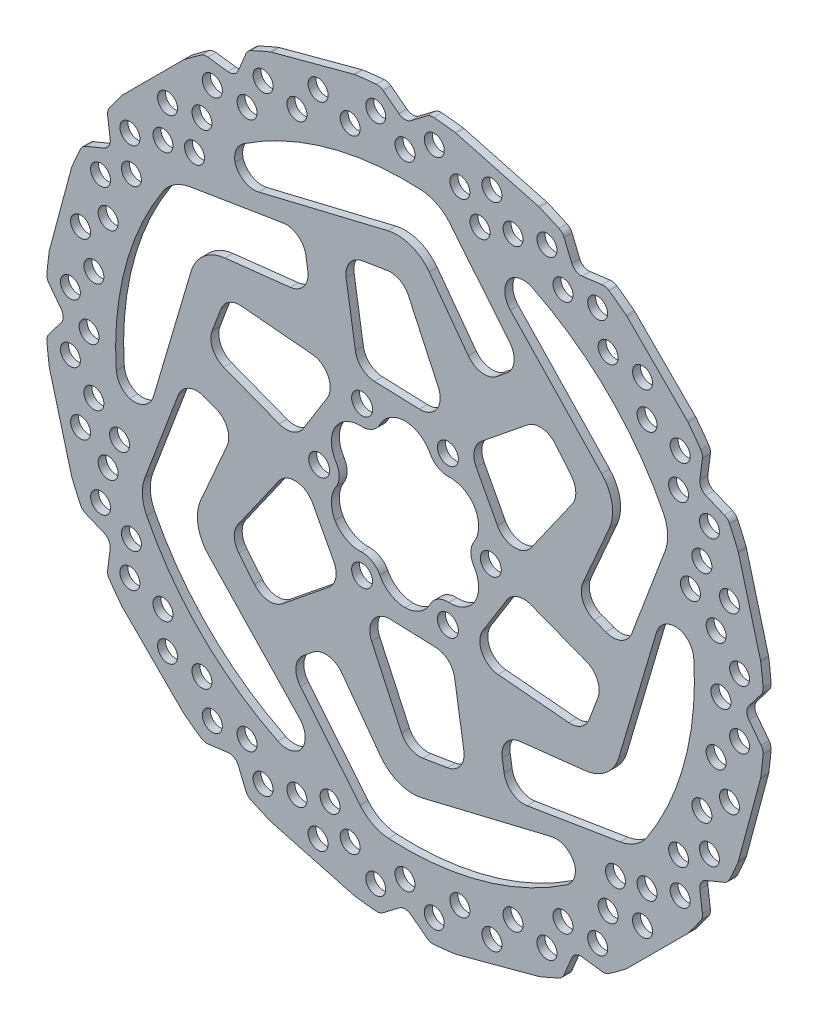
from build123d import *

# Parameters (mm, degrees)
BOSS_EXTRUDE1_DEPTH      = 1
BOSS_EXTRUDE1_DEPTH_BACK = 1
SKETCH3_R                = 90
CUT_EXTRUDE1_DEPTH       = 128.283148924
CUT_EXTRUDE1_DEPTH_BACK  = 128.283148924
SKETCH4_R                = 2.625
FILLET1_R                = 7.25
CUT_EXTRUDE2_DEPTH       = 128.283148924
FILLET2_R                = 5
FILLET3_R                = 10
CIRPATTERN1_COUNT        = 6
FILLET2_OF_CIRPATTERN1_R = 5
FILLET3_OF_CIRPATTERN1_R = 10
CUT_EXTRUDE3_DEPTH       = 128.283148924
CUT_EXTRUDE3_DEPTH_BACK  = 128.283148924
CUT_EXTRUDE4_DEPTH       = 128.283148924
CUT_EXTRUDE4_DEPTH_BACK  = 128.283148924
FILLET4_R                = 2.5
SKETCH8_R                = 2.5
CUT_EXTRUDE5_DEPTH       = 127.885081237
CIRPATTERN2_COUNT        = 6


with BuildPart() as part:
    # Sketch3 → Boss-Extrude1 (new, two sides: drawn at the far end of the back side and taken through both)
    with BuildSketch(Plane.XY.offset(-BOSS_EXTRUDE1_DEPTH_BACK)):
        Circle(SKETCH3_R)
    extrude(amount=BOSS_EXTRUDE1_DEPTH + BOSS_EXTRUDE1_DEPTH_BACK)

    # Sketch4 → Cut-Extrude1 (cut, two sides: drawn at the far end of the back side and taken through both)
    with BuildSketch(Plane.XY.offset(-CUT_EXTRUDE1_DEPTH_BACK)):
        with BuildLine():
            ThreePointArc((19.70494186, -4.666665434), (17.378392868, -2.830610297), (16.5, 0))
            ThreePointArc((16.5, 0), (17.378392868, 2.830610297), (19.70494186, 4.666665434))
            ThreePointArc((19.70494186, 4.666665434), (17.537014427, 10.125), (13.893921747, 14.731647514))
            ThreePointArc((13.893921747, 14.731647514), (8.25, 14.289419162), (5.811020113, 19.398312948))
            ThreePointArc((5.811020113, 19.398312948), (0, 20.25), (-5.811020113, 19.398312948))
            ThreePointArc((-5.811020113, 19.398312948), (-8.25, 14.289419162), (-13.893921747, 14.731647514))
            ThreePointArc((-13.893921747, 14.731647514), (-17.537014427, 10.125), (-19.70494186, 4.666665434))
            ThreePointArc((-19.70494186, 4.666665434), (-16.5, 0), (-19.70494186, -4.666665434))
            ThreePointArc((-19.70494186, -4.666665434), (-17.537014427, -10.125), (-13.893921747, -14.731647514))
            ThreePointArc((-13.893921747, -14.731647514), (-8.25, -14.289419162), (-5.811020113, -19.398312948))
            ThreePointArc((-5.811020113, -19.398312948), (0, -20.25), (5.811020113, -19.398312948))
            ThreePointArc((5.811020113, -19.398312948), (8.25, -14.289419162), (13.893921747, -14.731647514))
            ThreePointArc((13.893921747, -14.731647514), (17.537014427, -10.125), (19.70494186, -4.666665434))
        make_face()
        with Locations((21.5, 0)):
            Circle(SKETCH4_R)
        with Locations((10.75, 18.619546181)):
            Circle(SKETCH4_R)
        with Locations((10.75, -18.619546181)):
            Circle(SKETCH4_R)
        with Locations((-10.75, 18.619546181)):
            Circle(SKETCH4_R)
        with Locations((-10.75, -18.619546181)):
            Circle(SKETCH4_R)
        with Locations((-21.5, 0)):
            Circle(SKETCH4_R)
    extrude(amount=CUT_EXTRUDE1_DEPTH + CUT_EXTRUDE1_DEPTH_BACK, mode=Mode.SUBTRACT)

    # Fillet1
    # the kernel refuses this fillet: 7.25 mm, written as the material it adds along each edge
    with BuildSketch(Plane(origin=(19.70494186, 4.666665434, -1), x_dir=(-0.7752261871537995, -0.6316837490002274, 0), z_dir=(0, 0, 1)), Plane(origin=(19.70494186, -4.666665434, 1), x_dir=(-0.7752261871537981, 0.6316837490002291, 0), z_dir=(0, 0, -1)), Plane(origin=(-5.811020113, -19.398312948, -1), x_dir=(-0.15944108021504277, 0.9872074462542613, 0), z_dir=(0, 0, 1)), Plane(origin=(-19.70494186, -4.666665434, -1), x_dir=(0.775226187153803, 0.631683749000223, 0), z_dir=(0, 0, 1)), Plane(origin=(-13.893921747, 14.731647514, -1), x_dir=(0.934667267368866, -0.3555236972540884, 0), z_dir=(0, 0, 1)), Plane(origin=(5.811020113, 19.398312948, -1), x_dir=(0.1594410802150379, -0.9872074462542622, 0), z_dir=(0, 0, 1))) as fillet1_piece_1:
        with BuildLine():
            CenterArc((5.369168207, -6.889863945), FILLET1_R, 108.134946901, 63.284010814)
            ThreePointArc((-1.799673875, -5.808104633), (-1.119081846, -2.836118049), (0, 0))
            ThreePointArc((0, 0), (1.55628064, -0.248369693), (3.112561279, 0))
        make_face()
    extrude(amount=2)
    with BuildSketch(Plane(origin=(13.893921747, -14.731647514, 1), x_dir=(-0.934667267368868, 0.3555236972540833, 0), z_dir=(0, 0, -1))) as fillet1_piece_2:
        with BuildLine():
            CenterArc((5.369168207, 6.889863945), FILLET1_R, 188.581042285, 63.284010814)
            ThreePointArc((-1.799673875, 5.808104633), (-1.119081846, 2.836118049), (0, 0))
            ThreePointArc((0, 0), (1.55628064, 0.248369693), (3.112561279, 0))
        make_face()
    extrude(amount=2)
    with BuildSketch(Plane(origin=(5.811020113, -19.398312948, 1), x_dir=(-0.9901671681393868, -0.13988916733910237, 0), z_dir=(0, 0, -1))) as fillet1_piece_3:
        with BuildLine():
            CenterArc((4.992044139, 7.167823081), FILLET1_R, 215.35083581, 63.284010814)
            ThreePointArc((-0.921233946, 2.973107084), (-0.223375155, 1.560064253), (0, 0))
            ThreePointArc((0, 0), (3.040267483, -0.229528636), (6.080534967, 0))
        make_face()
    extrude(amount=2)
    with BuildSketch(Plane(origin=(-13.893921747, -14.731647514, -1), x_dir=(-0.6162311566996095, 0.7875653379324546, 0), z_dir=(0, 0, 1)), Plane(origin=(-19.70494186, 4.666665434, -1), x_dir=(0.37393601143979244, 0.927454505271552, 0), z_dir=(0, 0, 1)), Plane(origin=(-5.811020113, 19.398312948, -1), x_dir=(0.9901671681393878, 0.1398891673390949, 0), z_dir=(0, 0, 1)), Plane(origin=(13.893921747, 14.731647514, -1), x_dir=(0.6162311566996038, -0.787565337932459, 0), z_dir=(0, 0, 1))) as fillet1_piece_4:
        with BuildLine():
            CenterArc((4.992044139, -7.167823081), FILLET1_R, 81.365153376, 63.284010814)
            ThreePointArc((-0.921233946, -2.973107084), (-0.223375155, -1.560064253), (0, 0))
            ThreePointArc((0, 0), (3.040267483, 0.229528636), (6.080534967, 0))
        make_face()
    extrude(amount=2)

    # Sketch5 → Cut-Extrude2 (cut, symmetric)
    with BuildSketch(Plane.XY):
        Polygon((11.782448297, 24.332502266), (-0.719059801, 51.289888884), (-15.522638582, 48.870373376), (-11.782448297, 25.163602684), align=None)
        Polygon((-25.625607459, 48.739034198), (-53.640000232, 44.160326661), (-51.704387826, 32.317463636), (-23.530364561, 35.458575412), align=None)
        with BuildLine():
            Line((-53.640000232, 44.160326661), (-58.044631032, 43.440428271))
            ThreePointArc((-58.044631032, 43.440428271), (-70.012394298, 18.828559284), (-72.003979745, -8.46622117))
            Line((-72.003979745, -8.46622117), (-64.419336412, -10.707663695))
            Line((-64.419336412, -10.707663695), (-51.704387826, 32.317463636))
            Line((-51.704387826, 32.317463636), (-53.640000232, 44.160326661))
        make_face()
    cut_extrude2 = extrude(amount=CUT_EXTRUDE2_DEPTH, both=True, mode=Mode.SUBTRACT)

    # Fillet2
    # the kernel refuses this fillet: 5 mm, written as the material it adds along each edge
    with BuildSketch(Plane(origin=(-11.782448297, 25.163602684, 1), x_dir=(0.9993786432729305, -0.035246664664287344, 0), z_dir=(0, 0, -1))) as fillet2_piece_1:
        with BuildLine():
            CenterArc((FILLET2_R * 0.824549025934, -FILLET2_R), FILLET2_R, 90, 79.014506566)
            Line((-FILLET2_R * 0.157126436471, -FILLET2_R * 0.80943954631), (0, 0))
            Line((0, 0), (FILLET2_R * 0.824549025934, 0))
        make_face()
    extrude(amount=2)
    with BuildSketch(Plane(origin=(-0.719059801, 51.289888884, -1), x_dir=(0.4207120080891837, -0.9071942494579465, 0), z_dir=(0, 0, 1))) as fillet2_piece_2:
        with BuildLine():
            CenterArc((FILLET2_R * 0.759080833658, -FILLET2_R), FILLET2_R, 90, 74.402873242)
            Line((-FILLET2_R * 0.204095217592, -FILLET2_R * 0.731128479943), (0, 0))
            Line((0, 0), (FILLET2_R * 0.759080833658, 0))
        make_face()
    extrude(amount=2)
    with BuildSketch(Plane(origin=(11.782448297, 24.332502266, 1), x_dir=(-0.42071200808918324, 0.9071942494579465, 0), z_dir=(0, 0, -1))) as fillet2_piece_3:
        with BuildLine():
            CenterArc((FILLET2_R * 1.62864222131, -FILLET2_R), FILLET2_R, 90, 116.899451201)
            Line((FILLET2_R * 0.736840358169, -FILLET2_R * 1.45242616735), (0, 0))
            Line((0, 0), (FILLET2_R * 1.62864222131, 0))
        make_face()
    extrude(amount=2)
    with BuildSketch(Plane(origin=(-15.522638582, 48.870373376, -1), x_dir=(0.15584126183718117, -0.9877821121628976, 0), z_dir=(0, 0, 1))) as fillet2_piece_4:
        with BuildLine():
            CenterArc((FILLET2_R * 0.994485488589, FILLET2_R), FILLET2_R, 180.316831009, 89.683168991)
            Line((-FILLET2_R * 0.005499222414, FILLET2_R * 0.994470283903), (0, 0))
            Line((0, 0), (FILLET2_R * 0.994485488589, 0))
        make_face()
    extrude(amount=2)
    with BuildSketch(Plane(origin=(-64.419336412, -10.707663695, 1), x_dir=(0.28340721234532945, 0.9589996621431363, 0), z_dir=(0, 0, -1))) as fillet2_piece_5:
        with BuildLine():
            CenterArc((FILLET2_R, -FILLET2_R), FILLET2_R, 90, 90)
            Line((0, -FILLET2_R), (0, 0))
            Line((0, 0), (FILLET2_R, 0))
        make_face()
    extrude(amount=2)
    with BuildSketch(Plane(origin=(-72.003979745, -8.46622117, -1), x_dir=(0.9589996621431376, -0.2834072123453247, 0), z_dir=(0, 0, 1))) as fillet2_piece_6:
        with BuildLine():
            CenterArc((3.384730865, 5), FILLET2_R, 200.397226298, 69.602773702)
            ThreePointArc((-1.301763449, 3.257366636), (-0.670585229, 1.620809073), (0, 0))
            Line((0, 0), (3.384730865, 0))
        make_face()
    extrude(amount=2)
    with BuildSketch(Plane(origin=(-23.530364561, 35.458575412, 1), x_dir=(-0.1558412618371813, 0.9877821121628976, 0), z_dir=(0, 0, -1))) as fillet2_piece_7:
        with BuildLine():
            CenterArc((FILLET2_R * 1.04651290744, -FILLET2_R), FILLET2_R, 90, 92.603975326)
            Line((FILLET2_R * 0.0475454874519, -FILLET2_R * 1.04543229913), (0, 0))
            Line((0, 0), (FILLET2_R * 1.04651290744, 0))
        make_face()
    extrude(amount=2)
    with BuildSketch(Plane(origin=(-25.625607459, 48.739034198, -1), x_dir=(0.15584126183718192, -0.9877821121628975, 0), z_dir=(0, 0, 1))) as fillet2_piece_8:
        with BuildLine():
            CenterArc((FILLET2_R * 1.00554508987, -FILLET2_R), FILLET2_R, 90, 90.316831009)
            Line((FILLET2_R * 0.00556037886924, -FILLET2_R * 1.0055297161), (0, 0))
            Line((0, 0), (FILLET2_R * 1.00554508987, 0))
        make_face()
    extrude(amount=2)

    # Fillet3
    fillet3_edges = [part.edges().sort_by_distance(p)[0] for p in [
        (-58.044631032, 43.440428271, 0),
        (-51.704387826, 32.317463636, 0),
    ]]
    fillet(fillet3_edges, radius=FILLET3_R)

    # CirPattern1: Cut-Extrude2 ×6 about axis
    cirpattern1_axis = Axis((0, 0, 0), (0, 0, 1))
    for i in range(1, CIRPATTERN1_COUNT):
        add(cut_extrude2.rotate(cirpattern1_axis, i * 360 / CIRPATTERN1_COUNT), mode=Mode.SUBTRACT)

    # Fillet2 of CirPattern1
    # the kernel refuses this fillet: 5 mm, written as the material it adds along each edge
    with BuildSketch(Plane(origin=(-27.683543324, 2.377901798, 1), x_dir=(0.5302138286344097, 0.8478639607418403, 0), z_dir=(0, 0, -1)), Plane(origin=(-15.901095027, -22.785700887, 1), x_dir=(-0.46916481463852117, 0.8831106254061278, 0), z_dir=(0, 0, -1)), Plane(origin=(11.782448297, -25.163602684, 1), x_dir=(-0.9993786432729305, 0.03524666466428733, 0), z_dir=(0, 0, -1)), Plane(origin=(27.683543324, -2.377901798, 1), x_dir=(-0.5302138286344099, -0.84786396074184, 0), z_dir=(0, 0, -1)), Plane(origin=(15.901095027, 22.785700887, 1), x_dir=(0.4691648146385218, -0.8831106254061274, 0), z_dir=(0, 0, -1))) as fillet2_of_cirpattern1_piece_1:
        with BuildLine():
            CenterArc((FILLET2_OF_CIRPATTERN1_R * 0.824549025934, -FILLET2_OF_CIRPATTERN1_R), FILLET2_OF_CIRPATTERN1_R, 90, 79.014506566)
            Line((-FILLET2_OF_CIRPATTERN1_R * 0.157126436471, -FILLET2_OF_CIRPATTERN1_R * 0.80943954631), (0, 0))
            Line((0, 0), (FILLET2_OF_CIRPATTERN1_R * 0.824549025934, 0))
        make_face()
    extrude(amount=2)
    with BuildSketch(Plane(origin=(-44.777876631, 25.022220387, -1), x_dir=(0.9960092702423304, -0.0892498380465772, 0), z_dir=(0, 0, 1)), Plane(origin=(-44.05881683, -26.267668496, -1), x_dir=(0.5752972621531476, 0.81794441141137, 0), z_dir=(0, 0, 1)), Plane(origin=(0.719059801, -51.289888884, -1), x_dir=(-0.420712008089183, 0.9071942494579467, 0), z_dir=(0, 0, 1)), Plane(origin=(44.777876631, -25.022220387, -1), x_dir=(-0.9960092702423304, 0.08924983804657703, 0), z_dir=(0, 0, 1)), Plane(origin=(44.05881683, 26.267668496, -1), x_dir=(-0.5752972621531467, -0.8179444114113706, 0), z_dir=(0, 0, 1))) as fillet2_of_cirpattern1_piece_2:
        with BuildLine():
            CenterArc((FILLET2_OF_CIRPATTERN1_R * 0.759080833658, -FILLET2_OF_CIRPATTERN1_R), FILLET2_OF_CIRPATTERN1_R, 90, 74.402873242)
            Line((-FILLET2_OF_CIRPATTERN1_R * 0.204095217592, -FILLET2_OF_CIRPATTERN1_R * 0.731128479943), (0, 0))
            Line((0, 0), (FILLET2_OF_CIRPATTERN1_R * 0.759080833658, 0))
        make_face()
    extrude(amount=2)
    with BuildSketch(Plane(origin=(-15.181340952, 22.370150678, 1), x_dir=(-0.9960092702423307, 0.0892498380465763, 0), z_dir=(0, 0, -1)), Plane(origin=(-26.963789249, -1.962351589, 1), x_dir=(-0.5752972621531475, -0.8179444114113701, 0), z_dir=(0, 0, -1)), Plane(origin=(-11.782448297, -24.332502266, 1), x_dir=(0.4207120080891829, -0.9071942494579467, 0), z_dir=(0, 0, -1)), Plane(origin=(15.181340952, -22.370150678, 1), x_dir=(0.9960092702423304, -0.08924983804657716, 0), z_dir=(0, 0, -1)), Plane(origin=(26.963789249, 1.962351589, 1), x_dir=(0.5752972621531471, 0.8179444114113702, 0), z_dir=(0, 0, -1))) as fillet2_of_cirpattern1_piece_3:
        with BuildLine():
            CenterArc((FILLET2_OF_CIRPATTERN1_R * 1.62864222131, -FILLET2_OF_CIRPATTERN1_R), FILLET2_OF_CIRPATTERN1_R, 90, 116.899451201)
            Line((FILLET2_OF_CIRPATTERN1_R * 0.736840358169, -FILLET2_OF_CIRPATTERN1_R * 1.45242616735), (0, 0))
            Line((0, 0), (FILLET2_OF_CIRPATTERN1_R * 1.62864222131, 0))
        make_face()
    extrude(amount=2)
    with BuildSketch(Plane(origin=(-50.084304127, 10.992187343, -1), x_dir=(0.3537618330654844, 0.9353355363002885, 0), z_dir=(0, 0, 1)), Plane(origin=(-34.561665545, -37.878186033, -1), x_dir=(-0.6331434189656489, 0.7740345024742044, 0), z_dir=(0, 0, 1)), Plane(origin=(15.522638582, -48.870373376, -1), x_dir=(-0.9869052520311341, -0.1613010338260852, 0), z_dir=(0, 0, 1)), Plane(origin=(50.084304127, -10.992187343, -1), x_dir=(-0.35376183306548464, -0.9353355363002885, 0), z_dir=(0, 0, 1))) as fillet2_of_cirpattern1_piece_4:
        with BuildLine():
            CenterArc((FILLET2_OF_CIRPATTERN1_R * 0.994485488589, -FILLET2_OF_CIRPATTERN1_R), FILLET2_OF_CIRPATTERN1_R, 90, 89.683168991)
            Line((-FILLET2_OF_CIRPATTERN1_R * 0.005499222414, -FILLET2_OF_CIRPATTERN1_R * 0.994470283903), (0, 0))
            Line((0, 0), (FILLET2_OF_CIRPATTERN1_R * 0.994485488589, 0))
        make_face()
    extrude(amount=2)
    with BuildSketch(Plane(origin=(-22.936559431, -61.142613675, 1), x_dir=(-0.6888144634639863, 0.7249376765783528, 0), z_dir=(0, 0, -1)), Plane(origin=(41.482776981, -50.43494998, 1), x_dir=(-0.9722216758093141, -0.23406198556478378, 0), z_dir=(0, 0, -1)), Plane(origin=(64.419336412, 10.707663695, 1), x_dir=(-0.2834072123453266, -0.958999662143137, 0), z_dir=(0, 0, -1)), Plane(origin=(22.936559431, 61.142613675, 1), x_dir=(0.6888144634639857, -0.7249376765783536, 0), z_dir=(0, 0, -1)), Plane(origin=(-41.482776981, 50.43494998, 1), x_dir=(0.9722216758093141, 0.23406198556478378, 0), z_dir=(0, 0, -1))) as fillet2_of_cirpattern1_piece_5:
        with BuildLine():
            CenterArc((FILLET2_OF_CIRPATTERN1_R, -FILLET2_OF_CIRPATTERN1_R), FILLET2_OF_CIRPATTERN1_R, 90, 90)
            Line((0, -FILLET2_OF_CIRPATTERN1_R), (0, 0))
            Line((0, 0), (FILLET2_OF_CIRPATTERN1_R, 0))
        make_face()
    extrude(amount=2)
    with BuildSketch(Plane(origin=(-28.670027265, -66.590386218, -1), x_dir=(-0.9086525442541338, 0.4175530550965821, 0), z_dir=(0, 0, 1)), Plane(origin=(43.33395248, -58.124165047, -1), x_dir=(-0.8159378252685093, -0.5781396589891541, 0), z_dir=(0, 0, 1)), Plane(origin=(72.003979745, 8.46622117, -1), x_dir=(0.09271471898562496, -0.9956927140857348, 0), z_dir=(0, 0, 1)), Plane(origin=(28.670027265, 66.590386218, -1), x_dir=(0.9086525442541363, -0.41755305509657686, 0), z_dir=(0, 0, 1))) as fillet2_of_cirpattern1_piece_6:
        with BuildLine():
            CenterArc((3.386891562, -4.998536644), FILLET2_OF_CIRPATTERN1_R, 88.61376053, 69.602773702)
            Line((-1.25607322, -3.143037241), (0, 0))
            ThreePointArc((0, 0), (1.753925987, 0.021218666), (3.507851975, 0))
        make_face()
    extrude(amount=2)
    with BuildSketch(Plane(origin=(-42.473209369, -2.648605764, 1), x_dir=(-0.9333650334555095, 0.358928564372628, 0), z_dir=(0, 0, -1)), Plane(origin=(-18.942844808, -38.107181176, 1), x_dir=(-0.7775237716183285, -0.6288535477902699, 0), z_dir=(0, 0, -1)), Plane(origin=(23.530364561, -35.458575412, 1), x_dir=(0.15584126183718108, -0.9877821121628976, 0), z_dir=(0, 0, -1)), Plane(origin=(42.473209369, 2.648605764, 1), x_dir=(0.9333650334555095, -0.3589285643726278, 0), z_dir=(0, 0, -1)), Plane(origin=(18.942844808, 38.107181176, 1), x_dir=(0.7775237716183285, 0.6288535477902699, 0), z_dir=(0, 0, -1))) as fillet2_of_cirpattern1_piece_7:
        with BuildLine():
            CenterArc((FILLET2_OF_CIRPATTERN1_R * 1.04651290744, -FILLET2_OF_CIRPATTERN1_R), FILLET2_OF_CIRPATTERN1_R, 90, 92.603975326)
            Line((FILLET2_OF_CIRPATTERN1_R * 0.0475454874519, -FILLET2_OF_CIRPATTERN1_R * 1.04543229913), (0, 0))
            Line((0, 0), (FILLET2_OF_CIRPATTERN1_R * 1.04651290744, 0))
        make_face()
    extrude(amount=2)
    with BuildSketch(Plane(origin=(-55.022045501, 2.177090052, -1), x_dir=(0.9333650334555099, -0.3589285643726268, 0), z_dir=(0, 0, 1)), Plane(origin=(-29.396438042, -46.561944146, -1), x_dir=(0.7775237716183281, 0.6288535477902705, 0), z_dir=(0, 0, 1)), Plane(origin=(25.625607459, -48.739034198, -1), x_dir=(-0.15584126183718125, 0.9877821121628976, 0), z_dir=(0, 0, 1)), Plane(origin=(55.022045501, -2.177090052, -1), x_dir=(-0.9333650334555096, 0.3589285643726276, 0), z_dir=(0, 0, 1)), Plane(origin=(29.396438042, 46.561944146, -1), x_dir=(-0.7775237716183279, -0.6288535477902709, 0), z_dir=(0, 0, 1))) as fillet2_of_cirpattern1_piece_8:
        with BuildLine():
            CenterArc((FILLET2_OF_CIRPATTERN1_R * 1.00554508987, -FILLET2_OF_CIRPATTERN1_R), FILLET2_OF_CIRPATTERN1_R, 90, 90.316831009)
            Line((FILLET2_OF_CIRPATTERN1_R * 0.00556037886924, -FILLET2_OF_CIRPATTERN1_R * 1.0055297161), (0, 0))
            Line((0, 0), (FILLET2_OF_CIRPATTERN1_R * 1.00554508987, 0))
        make_face()
    extrude(amount=2)
    with BuildSketch(Plane(origin=(34.561665545, 37.878186033, -1), x_dir=(-0.7775237716183283, -0.6288535477902701, 0), z_dir=(0, 0, 1))) as fillet2_of_cirpattern1_piece_9:
        with BuildLine():
            CenterArc((FILLET2_OF_CIRPATTERN1_R * 0.994485488589, FILLET2_OF_CIRPATTERN1_R), FILLET2_OF_CIRPATTERN1_R, 180.316831009, 89.683168991)
            Line((-FILLET2_OF_CIRPATTERN1_R * 0.005499222414, FILLET2_OF_CIRPATTERN1_R * 0.994470283903), (0, 0))
            Line((0, 0), (FILLET2_OF_CIRPATTERN1_R * 0.994485488589, 0))
        make_face()
    extrude(amount=2)
    with BuildSketch(Plane(origin=(-43.33395248, 58.124165047, -1), x_dir=(0.2340619855647869, -0.9722216758093133, 0), z_dir=(0, 0, 1))) as fillet2_of_cirpattern1_piece_10:
        with BuildLine():
            CenterArc((3.384730865, 5), FILLET2_OF_CIRPATTERN1_R, 200.397226298, 69.602773702)
            ThreePointArc((-1.301763449, 3.257366636), (-0.670585229, 1.620809073), (0, 0))
            Line((0, 0), (3.384730865, 0))
        make_face()
    extrude(amount=2)

    # Fillet3 of CirPattern1
    fillet3_of_cirpattern1_edges = [part.edges().sort_by_distance(p)[0] for p in [
        (-66.64282995, -28.547910892, 0),
        (-53.839938408, -28.618581527, 0),
        (-8.598198918, -71.988339162, 0),
        (-2.135550582, -60.936045163, 0),
        (58.044631032, -43.440428271, 0),
        (51.704387826, -32.317463636, 0),
        (66.64282995, 28.547910892, 0),
        (53.839938408, 28.618581527, 0),
        (8.598198918, 71.988339162, 0),
        (2.135550582, 60.936045163, 0),
    ]]
    fillet(fillet3_of_cirpattern1_edges, radius=FILLET3_OF_CIRPATTERN1_R)

    # Sketch6 → Cut-Extrude3 (cut, two sides: drawn at the far end of the back side and taken through both)
    with BuildSketch(Plane.XY.offset(-CUT_EXTRUDE3_DEPTH_BACK)):
        with BuildLine():
            ThreePointArc((89.102154811, 12.680930881), (86.933324366, 23.293714059), (83.505195039, 33.569069119))
            Line((83.505195039, 33.569069119), (89.102154811, 12.680930881))
        make_face()
        with BuildLine():
            ThreePointArc((83.505195039, -33.569069119), (86.933324366, -23.293714059), (89.102154811, -12.680930881))
            Line((89.102154811, -12.680930881), (83.505195039, -33.569069119))
        make_face()
        with BuildLine():
            ThreePointArc((55.533085692, -70.824264158), (63.639610307, -63.639610307), (70.824264158, -55.533085692))
            Line((70.824264158, -55.533085692), (55.533085692, -70.824264158))
        make_face()
        with BuildLine():
            Line((33.569069119, -83.505195039), (12.680930881, -89.102154811))
            ThreePointArc((12.680930881, -89.102154811), (23.293714059, -86.933324366), (33.569069119, -83.505195039))
        make_face()
        with BuildLine():
            Line((-12.680930881, -89.102154811), (-33.569069119, -83.505195039))
            ThreePointArc((-33.569069119, -83.505195039), (-23.293714059, -86.933324366), (-12.680930881, -89.102154811))
        make_face()
        with BuildLine():
            Line((-55.533085692, -70.824264158), (-70.824264158, -55.533085692))
            ThreePointArc((-70.824264158, -55.533085692), (-63.639610307, -63.639610307), (-55.533085692, -70.824264158))
        make_face()
        with BuildLine():
            Line((-83.505195039, -33.569069119), (-89.102154811, -12.680930881))
            ThreePointArc((-89.102154811, -12.680930881), (-86.933324366, -23.293714059), (-83.505195039, -33.569069119))
        make_face()
        with BuildLine():
            Line((-89.102154811, 12.680930881), (-83.505195039, 33.569069119))
            ThreePointArc((-83.505195039, 33.569069119), (-86.933324366, 23.293714059), (-89.102154811, 12.680930881))
        make_face()
        with BuildLine():
            Line((-70.824264158, 55.533085692), (-55.533085692, 70.824264158))
            ThreePointArc((-55.533085692, 70.824264158), (-63.639610307, 63.639610307), (-70.824264158, 55.533085692))
        make_face()
        with BuildLine():
            ThreePointArc((-12.680930881, 89.102154811), (-23.293714059, 86.933324366), (-33.569069119, 83.505195039))
            Line((-33.569069119, 83.505195039), (-12.680930881, 89.102154811))
        make_face()
        with BuildLine():
            ThreePointArc((33.569069119, 83.505195039), (23.293714059, 86.933324366), (12.680930881, 89.102154811))
            Line((12.680930881, 89.102154811), (33.569069119, 83.505195039))
        make_face()
        with BuildLine():
            ThreePointArc((70.824264158, 55.533085692), (63.639610307, 63.639610307), (55.533085692, 70.824264158))
            Line((55.533085692, 70.824264158), (70.824264158, 55.533085692))
        make_face()
    extrude(amount=CUT_EXTRUDE3_DEPTH + CUT_EXTRUDE3_DEPTH_BACK, mode=Mode.SUBTRACT)

    # Sketch7 → Cut-Extrude4 (cut, two sides: drawn at the far end of the back side and taken through both)
    with BuildSketch(Plane.XY.offset(-CUT_EXTRUDE4_DEPTH_BACK)):
        with BuildLine():
            Line((85, 0), (89.782723839, -6.25))
            ThreePointArc((89.782723839, -6.25), (89.945664558, -3.126887787), (90, 0))
            ThreePointArc((90, 0), (89.945664558, 3.126887787), (89.782723839, 6.25))
            Line((89.782723839, 6.25), (85, 0))
        make_face()
        with BuildLine():
            Line((73.612159322, 42.5), (80.879119666, 39.478703146))
            ThreePointArc((80.879119666, 39.478703146), (77.942286341, 45), (74.629119666, 50.304020693))
            Line((74.629119666, 50.304020693), (73.612159322, 42.5))
        make_face()
        with BuildLine():
            Line((42.5, 73.612159322), (50.304020693, 74.629119666))
            ThreePointArc((50.304020693, 74.629119666), (45, 77.942286341), (39.478703146, 80.879119666))
            Line((39.478703146, 80.879119666), (42.5, 73.612159322))
        make_face()
        with BuildLine():
            Line((-42.5, 73.612159322), (-39.478703146, 80.879119666))
            ThreePointArc((-39.478703146, 80.879119666), (-45, 77.942286341), (-50.304020693, 74.629119666))
            Line((-50.304020693, 74.629119666), (-42.5, 73.612159322))
        make_face()
        with BuildLine():
            Line((-73.612159322, 42.5), (-74.629119666, 50.304020693))
            ThreePointArc((-74.629119666, 50.304020693), (-77.942286341, 45), (-80.879119666, 39.478703146))
            Line((-80.879119666, 39.478703146), (-73.612159322, 42.5))
        make_face()
        with BuildLine():
            ThreePointArc((-89.782723839, 6.25), (-90, 0), (-89.782723839, -6.25))
            Line((-89.782723839, -6.25), (-85, 0))
            Line((-85, 0), (-89.782723839, 6.25))
        make_face()
        with BuildLine():
            ThreePointArc((-80.879119666, -39.478703146), (-77.942286341, -45), (-74.629119666, -50.304020693))
            Line((-74.629119666, -50.304020693), (-73.612159322, -42.5))
            Line((-73.612159322, -42.5), (-80.879119666, -39.478703146))
        make_face()
        with BuildLine():
            ThreePointArc((39.478703146, -80.879119666), (45, -77.942286341), (50.304020693, -74.629119666))
            Line((50.304020693, -74.629119666), (42.5, -73.612159322))
            Line((42.5, -73.612159322), (39.478703146, -80.879119666))
        make_face()
        with BuildLine():
            ThreePointArc((-6.25, -89.782723839), (0, -90), (6.25, -89.782723839))
            Line((6.25, -89.782723839), (0, -85))
            Line((0, -85), (-6.25, -89.782723839))
        make_face()
        with BuildLine():
            ThreePointArc((-50.304020693, -74.629119666), (-45, -77.942286341), (-39.478703146, -80.879119666))
            Line((-39.478703146, -80.879119666), (-42.5, -73.612159322))
            Line((-42.5, -73.612159322), (-50.304020693, -74.629119666))
        make_face()
        with BuildLine():
            ThreePointArc((74.629119666, -50.304020693), (77.942286341, -45), (80.879119666, -39.478703146))
            Line((80.879119666, -39.478703146), (73.612159322, -42.5))
            Line((73.612159322, -42.5), (74.629119666, -50.304020693))
        make_face()
        with BuildLine():
            Line((0, 85), (6.25, 89.782723839))
            ThreePointArc((6.25, 89.782723839), (0, 90), (-6.25, 89.782723839))
            Line((-6.25, 89.782723839), (0, 85))
        make_face()
    extrude(amount=CUT_EXTRUDE4_DEPTH + CUT_EXTRUDE4_DEPTH_BACK, mode=Mode.SUBTRACT)

    # Fillet4
    fillet4_edges = [part.edges().sort_by_distance(p)[0] for p in [
        (83.505195039, -33.569069119, 0),
        (89.102154811, -12.680930881, 0),
        (55.533085692, -70.824264158, 0),
        (70.824264158, -55.533085692, 0),
        (12.680930881, -89.102154811, 0),
        (33.569069119, -83.505195039, 0),
        (-33.569069119, -83.505195039, 0),
        (-12.680930881, -89.102154811, 0),
        (-70.824264158, -55.533085692, 0),
        (-55.533085692, -70.824264158, 0),
        (-89.102154811, -12.680930881, 0),
        (-83.505195039, -33.569069119, 0),
        (-83.505195039, 33.569069119, 0),
        (-89.102154811, 12.680930881, 0),
        (-55.533085692, 70.824264158, 0),
        (-70.824264158, 55.533085692, 0),
        (-12.680930881, 89.102154811, 0),
        (-33.569069119, 83.505195039, 0),
        (33.569069119, 83.505195039, 0),
        (12.680930881, 89.102154811, 0),
        (70.824264158, 55.533085692, 0),
        (55.533085692, 70.824264158, 0),
        (89.102154811, 12.680930881, 0),
        (83.505195039, 33.569069119, 0),
        (89.782723839, -6.25, 0),
        (85, 0, 0),
        (89.782723839, 6.25, 0),
        (6.25, 89.782723839, 0),
        (0, 85, 0),
        (-6.25, 89.782723839, 0),
        (74.629119666, -50.304020693, 0),
        (73.612159322, -42.5, 0),
        (80.879119666, -39.478703146, 0),
        (-50.304020693, -74.629119666, 0),
        (-42.5, -73.612159322, 0),
        (-39.478703146, -80.879119666, 0),
        (-6.25, -89.782723839, 0),
        (0, -85, 0),
        (6.25, -89.782723839, 0),
        (39.478703146, -80.879119666, 0),
        (42.5, -73.612159322, 0),
        (50.304020693, -74.629119666, 0),
        (-80.879119666, -39.478703146, 0),
        (-73.612159322, -42.5, 0),
        (-74.629119666, -50.304020693, 0),
        (-89.782723839, 6.25, 0),
        (-85, 0, 0),
        (-89.782723839, -6.25, 0),
        (-74.629119666, 50.304020693, 0),
        (-73.612159322, 42.5, 0),
        (-80.879119666, 39.478703146, 0),
        (-39.478703146, 80.879119666, 0),
        (-42.5, 73.612159322, 0),
        (-50.304020693, 74.629119666, 0),
        (50.304020693, 74.629119666, 0),
        (42.5, 73.612159322, 0),
        (39.478703146, 80.879119666, 0),
        (80.879119666, 39.478703146, 0),
        (73.612159322, 42.5, 0),
        (74.629119666, 50.304020693, 0),
    ]]
    fillet(fillet4_edges, radius=FILLET4_R)

    # Sketch8 → Cut-Extrude5 (cut, symmetric)
    with BuildSketch(Plane.XY):
        with Locations((79.148001203, 0)):
            Circle(SKETCH8_R)
        with Locations((83.827792653, -7.333981546)):
            Circle(SKETCH8_R)
        with Locations((77.94556522, -13.743906175)):
            Circle(SKETCH8_R)
        with Locations((81.280727592, -21.779105319)):
            Circle(SKETCH8_R)
        with Locations((74.37479268, -27.070210715)):
            Circle(SKETCH8_R)
        with Locations((76.263988753, -35.562481997)):
            Circle(SKETCH8_R)
        with Locations((83.827792653, 7.333981546)):
            Circle(SKETCH8_R)
        with Locations((77.94556522, 13.743906175)):
            Circle(SKETCH8_R)
        with Locations((81.280727592, 21.779105319)):
            Circle(SKETCH8_R)
        with Locations((74.37479268, 27.070210715)):
            Circle(SKETCH8_R)
        with Locations((71.510868524, 19.599024599)):
            Circle(SKETCH8_R)
        with Locations((76.263988753, 35.562481997)):
            Circle(SKETCH8_R)
        with Locations((68.5441797, 39.574000601)):
            Circle(SKETCH8_R)
    cut_extrude5 = extrude(amount=CUT_EXTRUDE5_DEPTH, both=True, mode=Mode.SUBTRACT)

    # CirPattern2: Cut-Extrude5 ×6 about axis
    cirpattern2_axis = Axis((0, 0, 0), (0, 0, 1))
    for i in range(1, CIRPATTERN2_COUNT):
        add(cut_extrude5.rotate(cirpattern2_axis, i * 360 / CIRPATTERN2_COUNT), mode=Mode.SUBTRACT)


solid = part.part
